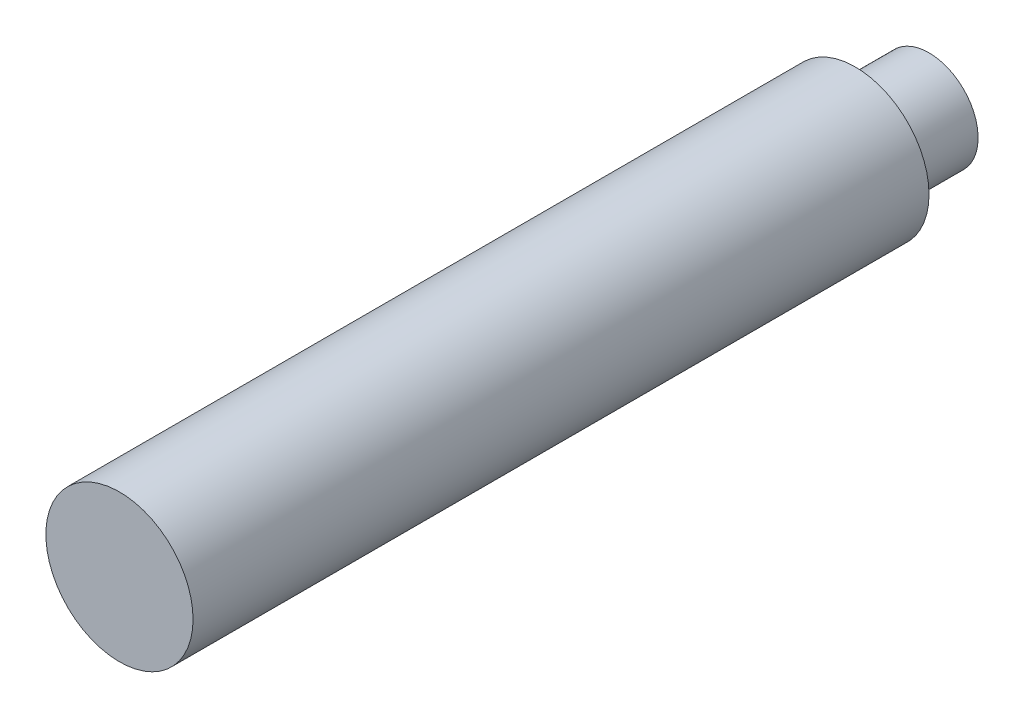
from build123d import *

# Parameters (mm, degrees)
SKETCH1_R           = 3
BOSS_EXTRUDE1_DEPTH = 30
SKETCH2_R           = 2
BOSS_EXTRUDE2_DEPTH = 3


with BuildPart() as part:
    # Sketch1 → Boss-Extrude1 (new body)
    with BuildSketch(Plane.XY):
        Circle(SKETCH1_R)
    extrude(amount=BOSS_EXTRUDE1_DEPTH)

    # Sketch2 → Boss-Extrude2 (add)
    with BuildSketch(Plane(origin=(0, 0, 0), x_dir=(-1, 0, 0), z_dir=(0, 0, -1))):
        Circle(SKETCH2_R)
    extrude(amount=BOSS_EXTRUDE2_DEPTH)


solid = part.part
